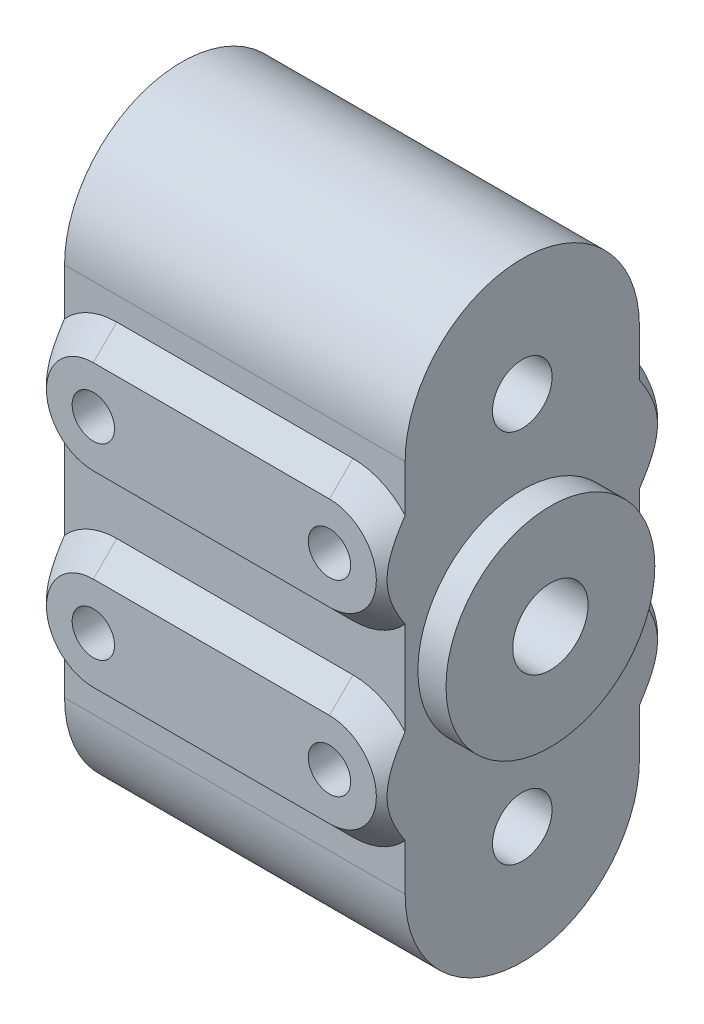
from build123d import *

# Parameters (mm, degrees)
BOSS_EXTRUDE1_DEPTH                      = 23.075011
SKETCH8_R                                = 7.0739
BOSS_EXTRUDE2_DEPTH                      = 1.905
F_1_4_20_TAPPED_HOLE1_D                  = 5.1054
F_10_32_TAPPED_HOLE1_D                   = 4.0386
BOSS_EXTRUDE3_DEPTH                      = 2.54
BOSS_EXTRUDE3_DRAFT                      = 45
MIRROR1_COPY_1_DEPTH                     = 2.54
MIRROR1_COPY_1_DRAFT                     = 45
MIRROR1_AT_THE_SECOND_PLANE_COPY_1_DEPTH = 2.54
MIRROR1_AT_THE_SECOND_PLANE_COPY_1_DRAFT = 45
MIRROR1_AT_THE_SECOND_PLANE_COPY_2_DEPTH = 2.54
MIRROR1_AT_THE_SECOND_PLANE_COPY_2_DRAFT = 45
SKETCH14_W                               = 19.05
SKETCH14_H                               = 41.275
CUT_EXTRUDE1_DEPTH                       = 34.975300812
SKETCH15_W                               = 19.05
SKETCH15_H                               = 41.275
SKETCH15_R                               = 7.0739
CUT_EXTRUDE2_DEPTH                       = 33.3896305
F_6_40_TAPPED_HOLE1_D                    = 2.8702
F_13_64_0_20313_DIAMETER_HOLE1_D         = 5.159502
F_13_64_0_20313_DIAMETER_HOLE1_DEPTH     = 3.175
F_13_64_0_20313_DIAMETER_HOLE1_TIP       = 1.550070783


with BuildPart() as part:
    # Sketch1 → Boss-Extrude1 (new body)
    with BuildSketch(Plane(origin=(0, 0, 0), x_dir=(0, 0, -1), z_dir=(1, 0, 0))):
        with BuildLine():
            Line((7.9375, 12.7), (7.9375, -12.7))
            ThreePointArc((7.9375, -12.7), (0, -20.6375), (-7.9375, -12.7))
            Line((-7.9375, -12.7), (-7.9375, 12.7))
            ThreePointArc((-7.9375, 12.7), (0, 20.6375), (7.9375, 12.7))
        make_face()
    extrude(amount=BOSS_EXTRUDE1_DEPTH)

    # Sketch8 → Boss-Extrude2 (add)
    with BuildSketch(Plane(origin=(23.075011, 0, 0), x_dir=(0, 0, -1), z_dir=(1, 0, 0))):
        Circle(SKETCH8_R)
    extrude(amount=BOSS_EXTRUDE2_DEPTH)

    # 1/4-20 Tapped Hole1 (through all)
    with Locations(Plane(origin=(24.980011, 0, 0), x_dir=(0, 0, -1), z_dir=(1, 0, 0))):
        with Locations((0, 0)):
            Hole(F_1_4_20_TAPPED_HOLE1_D / 2)

    # #10-32 Tapped Hole1 (through all)
    with Locations(Plane(origin=(23.075011, 0, 0), x_dir=(0, 0, -1), z_dir=(1, 0, 0))):
        with Locations((0, 12.7), (0, -12.7)):
            Hole(F_10_32_TAPPED_HOLE1_D / 2)


with BuildPart() as boss_extrude3_tool:
    # Sketch13 → Boss-Extrude3 (with draft: the straight prism first)
    with BuildSketch(Plane.XY.offset(9.525)):
        with BuildLine():
            ThreePointArc((3.5375055, 9.525), (0.3625055, 6.35), (3.5375055, 3.175))
            Line((3.5375055, 3.175), (19.5375055, 3.175))
            ThreePointArc((19.5375055, 3.175), (22.7125055, 6.35), (19.5375055, 9.525))
            Line((19.5375055, 9.525), (3.5375055, 9.525))
        make_face()
    extrude(amount=-BOSS_EXTRUDE3_DEPTH)
    # Boss-Extrude3: the draft: its side faces are tilted about the plane it starts from
    boss_extrude3_sides = [boss_extrude3_tool.faces().sort_by_distance(p)[0] for p in [
        (11.5375055, 3.175, 8.255),
        (22.7125055, 6.35, 8.255),
        (11.5375055, 9.525, 8.255),
        (0.3625055, 6.35, 8.255),
    ]]
    draft(boss_extrude3_sides, Plane.XY.offset(9.525), BOSS_EXTRUDE3_DRAFT)


with BuildPart() as part_1:
    add(part.part)

    # Boss-Extrude3: add boss_extrude3_tool
    add(boss_extrude3_tool.part)


with BuildPart() as mirror1_copy_1_tool:
    # Mirror1 copy 1 sketch → Mirror1 copy 1 (with draft: the straight prism first)
    with BuildSketch(Plane.XY.offset(9.525)):
        with BuildLine():
            ThreePointArc((3.5375055, -9.525), (0.3625055, -6.35), (3.5375055, -3.175))
            Line((3.5375055, -3.175), (19.5375055, -3.175))
            ThreePointArc((19.5375055, -3.175), (22.7125055, -6.35), (19.5375055, -9.525))
            Line((19.5375055, -9.525), (3.5375055, -9.525))
        make_face()
    extrude(amount=-MIRROR1_COPY_1_DEPTH)
    # Mirror1 copy 1: the draft: its side faces are tilted about the plane it starts from
    mirror1_copy_1_sides = [mirror1_copy_1_tool.faces().sort_by_distance(p)[0] for p in [
        (11.5375055, -3.175, 8.255),
        (22.7125055, -6.35, 8.255),
        (11.5375055, -9.525, 8.255),
        (0.3625055, -6.35, 8.255),
    ]]
    draft(mirror1_copy_1_sides, Plane.XY.offset(9.525), MIRROR1_COPY_1_DRAFT)


with BuildPart() as part_2:
    add(part_1.part)

    # Mirror1 copy 1: add mirror1_copy_1_tool
    add(mirror1_copy_1_tool.part)


with BuildPart() as mirror1_at_the_second_plane_copy_1_tool:
    # Mirror1 at the second plane copy 1 sketc → Mirror1 at the second plane copy 1 (with draft: the straight prism first)
    with BuildSketch(Plane(origin=(0, 0, -9.525), x_dir=(1, 0, 0), z_dir=(0, 0, -1))):
        with BuildLine():
            ThreePointArc((3.5375055, -9.525), (0.3625055, -6.35), (3.5375055, -3.175))
            Line((3.5375055, -3.175), (19.5375055, -3.175))
            ThreePointArc((19.5375055, -3.175), (22.7125055, -6.35), (19.5375055, -9.525))
            Line((19.5375055, -9.525), (3.5375055, -9.525))
        make_face()
    extrude(amount=-MIRROR1_AT_THE_SECOND_PLANE_COPY_1_DEPTH)
    # Mirror1 at the second plane copy 1: the draft: its side faces are tilted about the plane it starts from
    mirror1_at_the_second_plane_copy_1_sides = [mirror1_at_the_second_plane_copy_1_tool.faces().sort_by_distance(p)[0] for p in [
        (11.5375055, 3.175, -8.255),
        (22.7125055, 6.35, -8.255),
        (11.5375055, 9.525, -8.255),
        (0.3625055, 6.35, -8.255),
    ]]
    draft(mirror1_at_the_second_plane_copy_1_sides, Plane(origin=(0, 0, -9.525), x_dir=(1, 0, 0), z_dir=(0, 0, -1)), MIRROR1_AT_THE_SECOND_PLANE_COPY_1_DRAFT)


with BuildPart() as part_3:
    add(part_2.part)

    # Mirror1 at the second plane copy 1: add mirror1_at_the_second_plane_copy_1_tool
    add(mirror1_at_the_second_plane_copy_1_tool.part)


with BuildPart() as mirror1_at_the_second_plane_copy_2_tool:
    # Mirror1 at the second plane copy 2 sketc → Mirror1 at the second plane copy 2 (with draft: the straight prism first)
    with BuildSketch(Plane(origin=(0, 0, -9.525), x_dir=(1, 0, 0), z_dir=(0, 0, -1))):
        with BuildLine():
            ThreePointArc((3.5375055, 9.525), (0.3625055, 6.35), (3.5375055, 3.175))
            Line((3.5375055, 3.175), (19.5375055, 3.175))
            ThreePointArc((19.5375055, 3.175), (22.7125055, 6.35), (19.5375055, 9.525))
            Line((19.5375055, 9.525), (3.5375055, 9.525))
        make_face()
    extrude(amount=-MIRROR1_AT_THE_SECOND_PLANE_COPY_2_DEPTH)
    # Mirror1 at the second plane copy 2: the draft: its side faces are tilted about the plane it starts from
    mirror1_at_the_second_plane_copy_2_sides = [mirror1_at_the_second_plane_copy_2_tool.faces().sort_by_distance(p)[0] for p in [
        (11.5375055, -3.175, -8.255),
        (22.7125055, -6.35, -8.255),
        (11.5375055, -9.525, -8.255),
        (0.3625055, -6.35, -8.255),
    ]]
    draft(mirror1_at_the_second_plane_copy_2_sides, Plane(origin=(0, 0, -9.525), x_dir=(1, 0, 0), z_dir=(0, 0, -1)), MIRROR1_AT_THE_SECOND_PLANE_COPY_2_DRAFT)


with BuildPart() as part_4:
    add(part_3.part)

    # Mirror1 at the second plane copy 2: add mirror1_at_the_second_plane_copy_2_tool
    add(mirror1_at_the_second_plane_copy_2_tool.part)

    # Sketch14 → Cut-Extrude1 (cut, through all)
    with BuildSketch(Plane.ZY):
        Rectangle(SKETCH14_W, SKETCH14_H)
    extrude(amount=CUT_EXTRUDE1_DEPTH, mode=Mode.SUBTRACT)

    # Sketch15 → Cut-Extrude2 (cut, through all)
    with BuildSketch(Plane(origin=(23.075011, 0, 0), x_dir=(0, 0, -1), z_dir=(1, 0, 0))):
        Rectangle(SKETCH15_W, SKETCH15_H)
        Circle(SKETCH15_R, mode=Mode.SUBTRACT)
    extrude(amount=CUT_EXTRUDE2_DEPTH, mode=Mode.SUBTRACT)

    # #6-40 Tapped Hole1 (through all)
    with Locations(Plane.XY.offset(9.525)):
        with Locations((3.5375055, 6.35), (19.5375055, 6.35), (3.5375055, -6.35), (19.5375055, -6.35)):
            Hole(F_6_40_TAPPED_HOLE1_D / 2)

    # 13/64 (0.20313) Diameter Hole1
    with Locations(Plane.ZY):
        with Locations((0, -12.7), (0, 12.7)):
            Hole(F_13_64_0_20313_DIAMETER_HOLE1_D / 2, depth=F_13_64_0_20313_DIAMETER_HOLE1_DEPTH)
            with Locations((0, 0, -(F_13_64_0_20313_DIAMETER_HOLE1_DEPTH + F_13_64_0_20313_DIAMETER_HOLE1_TIP / 2))):  # 118° drill point
                Cone(0, F_13_64_0_20313_DIAMETER_HOLE1_D / 2, F_13_64_0_20313_DIAMETER_HOLE1_TIP, mode=Mode.SUBTRACT)


solid = part_4.part
